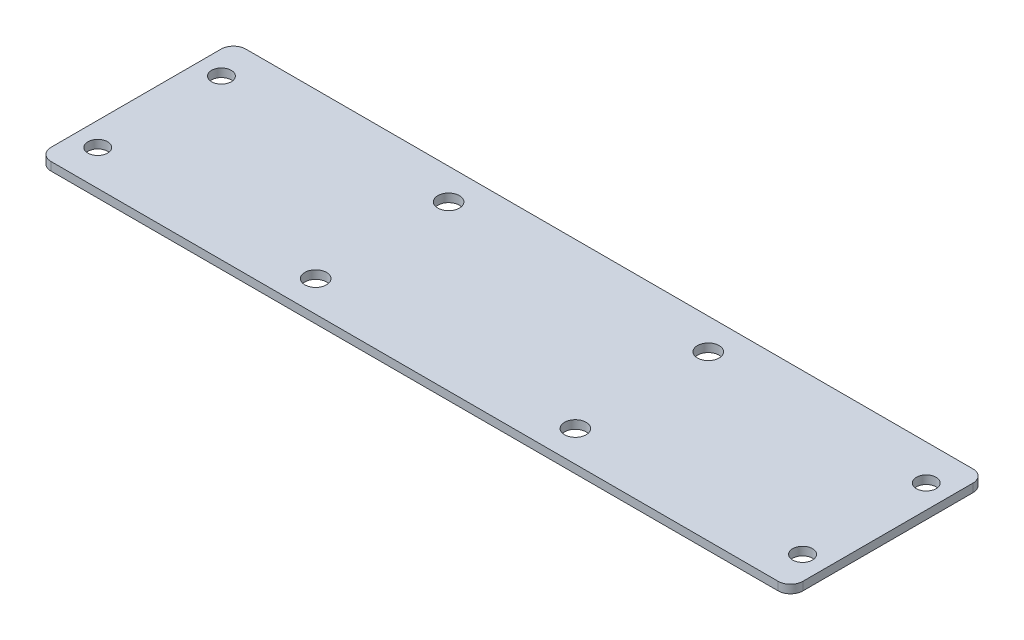
from build123d import *

# Parameters (mm, degrees)
SKETCH2_W           = 121.6
SKETCH2_H           = 31.5
SKETCH2_R           = 1.6
BOSS_EXTRUDE1_DEPTH = 1.35
FILLET1_R           = 2
SKETCH3_R           = 1.75
CUT_EXTRUDE1_DEPTH  = 63.821373751


with BuildPart() as part:
    # Sketch2 → Boss-Extrude1 (new body)
    with BuildSketch(Plane(origin=(0, 0, 0), x_dir=(1, 0, 0), z_dir=(0, 1, 0))):
        Rectangle(SKETCH2_W, SKETCH2_H)
        with Locations((-57, 10)):
            Circle(SKETCH2_R, mode=Mode.SUBTRACT)
        with Locations((-57, -10)):
            Circle(SKETCH2_R, mode=Mode.SUBTRACT)
        with Locations((57, 10)):
            Circle(SKETCH2_R, mode=Mode.SUBTRACT)
        with Locations((57, -10)):
            Circle(SKETCH2_R, mode=Mode.SUBTRACT)
    extrude(amount=-BOSS_EXTRUDE1_DEPTH)

    # Fillet1
    fillet1_edges = [part.edges().sort_by_distance(p)[0] for p in [
        (-60.8, -0.675, -15.75),
        (60.8, -0.675, -15.75),
        (60.8, -0.675, 15.75),
        (-60.8, -0.675, 15.75),
    ]]
    fillet(fillet1_edges, radius=FILLET1_R)

    # Sketch3 → Cut-Extrude1 (cut, through all)
    with BuildSketch(Plane(origin=(0, 0, 0), x_dir=(1, 0, 0), z_dir=(0, 1, 0))):
        with Locations((-21, -10.75)):
            Circle(SKETCH3_R)
        with Locations((21, -10.75)):
            Circle(SKETCH3_R)
        with Locations((21, 10.75)):
            Circle(SKETCH3_R)
        with Locations((-21, 10.75)):
            Circle(SKETCH3_R)
    extrude(amount=-CUT_EXTRUDE1_DEPTH, mode=Mode.SUBTRACT)


solid = part.part
